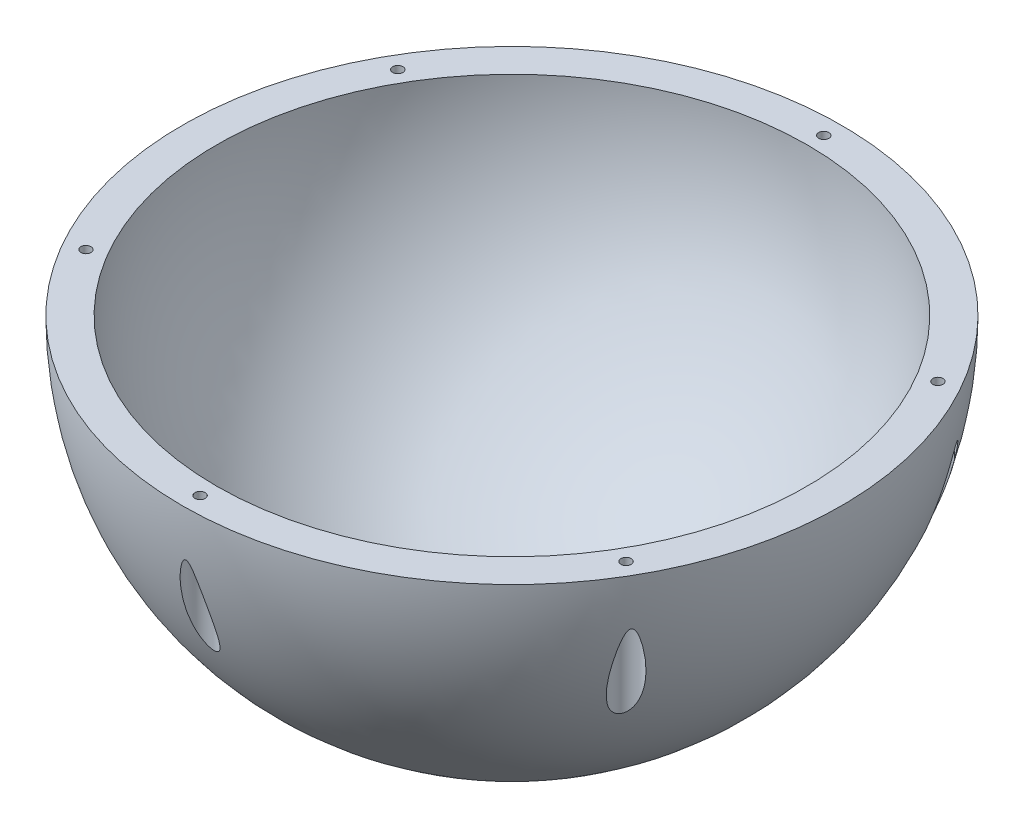
from build123d import *

# Parameters (mm, degrees)
SKETCH1_R           = 92.075
BOSS_EXTRUDE3_DEPTH = 92.075
SKETCH3_R           = 82.55
CUT_EXTRUDE1_DEPTH  = 82.55
FILLET12_R          = 82.55
FILLET13_R          = 92.075
SKETCH6_R           = 3.937
CUT_EXTRUDE3_DEPTH  = 50.8
SKETCH8_R           = 3.937
SKETCH8_R_2         = 1.4224
BOSS_EXTRUDE6_DEPTH = 3.175


with BuildPart() as part:
    # Sketch1 → Boss-Extrude3 (new body)
    with BuildSketch(Plane(origin=(0, 0, 0), x_dir=(1, 0, 0), z_dir=(0, 1, 0))):
        with Locations(Location((0, 0, 0), (0, 0, 270))):
            Circle(SKETCH1_R)
    extrude(amount=BOSS_EXTRUDE3_DEPTH)

    # Sketch3 → Cut-Extrude1 (cut)
    with BuildSketch(Plane(origin=(0, 92.075, 0), x_dir=(1, 0, 0), z_dir=(0, 1, 0))):
        with Locations(Location((0, 0, 0), (0, 0, 270))):
            Circle(SKETCH3_R)
    extrude(amount=-CUT_EXTRUDE1_DEPTH, mode=Mode.SUBTRACT)

    # Fillet12
    fillet12_edges = [part.edges().sort_by_distance(p)[0] for p in [
        (0, 9.525, -82.55),
    ]]
    fillet(fillet12_edges, radius=FILLET12_R - 0.0001)  # a hair under: the kernel refuses the full size

    # Fillet13
    fillet13_edges = [part.edges().sort_by_distance(p)[0] for p in [
        (0, 0, -92.075),
    ]]
    fillet(fillet13_edges, radius=FILLET13_R - 0.0001)  # a hair under: the kernel refuses the full size

    # Sketch6 → Cut-Extrude3 (cut)
    with BuildSketch(Plane(origin=(0, 92.075, 0), x_dir=(1, 0, 0), z_dir=(0, 1, 0))):
        with Locations(Location((0, 87.122, 0), (0, 0, 270))):
            Circle(SKETCH6_R)
        with Locations(Location((75.449865229, 43.561, 0), (0, 0, 270))):
            Circle(SKETCH6_R)
        with Locations(Location((75.449865229, -43.561, 0), (0, 0, 270))):
            Circle(SKETCH6_R)
        with Locations(Location((0, -87.122, 0), (0, 0, 270))):
            Circle(SKETCH6_R)
        with Locations(Location((-75.449865229, -43.561, 0), (0, 0, 270))):
            Circle(SKETCH6_R)
        with Locations(Location((-75.449865229, 43.561, 0), (0, 0, 270))):
            Circle(SKETCH6_R)
    extrude(amount=-CUT_EXTRUDE3_DEPTH, mode=Mode.SUBTRACT)

    # Sketch8 → Boss-Extrude6 (add)
    # profile 1 of 6: a face of its own
    with BuildSketch(Plane(origin=(0, 92.075, 0), x_dir=(1, 0, 0), z_dir=(0, 1, 0))):
        with Locations(Location((-75.449865229, -43.561, 0), (0, 0, 270))):
            Circle(SKETCH8_R)
        with Locations(Location((-75.449865229, -43.561, 0), (0, 0, 270))):
            Circle(SKETCH8_R_2, mode=Mode.SUBTRACT)
    # profile 2 of 6: a face of its own
    with BuildSketch(Plane(origin=(0, 92.075, 0), x_dir=(1, 0, 0), z_dir=(0, 1, 0))):
        with Locations(Location((0, -87.122, 0), (0, 0, 270))):
            Circle(SKETCH8_R)
        with Locations(Location((0, -87.122, 0), (0, 0, 270))):
            Circle(SKETCH8_R_2, mode=Mode.SUBTRACT)
    # profile 3 of 6: a face of its own
    with BuildSketch(Plane(origin=(0, 92.075, 0), x_dir=(1, 0, 0), z_dir=(0, 1, 0))):
        with Locations(Location((75.449865229, -43.561, 0), (0, 0, 270))):
            Circle(SKETCH8_R)
        with Locations(Location((75.449865229, -43.561, 0), (0, 0, 270))):
            Circle(SKETCH8_R_2, mode=Mode.SUBTRACT)
    # profile 4 of 6: a face of its own
    with BuildSketch(Plane(origin=(0, 92.075, 0), x_dir=(1, 0, 0), z_dir=(0, 1, 0))):
        with Locations(Location((75.449865229, 43.561, 0), (0, 0, 270))):
            Circle(SKETCH8_R)
        with Locations(Location((75.449865229, 43.561, 0), (0, 0, 270))):
            Circle(SKETCH8_R_2, mode=Mode.SUBTRACT)
    # profile 5 of 6: a face of its own
    with BuildSketch(Plane(origin=(0, 92.075, 0), x_dir=(1, 0, 0), z_dir=(0, 1, 0))):
        with Locations(Location((0, 87.122, 0), (0, 0, 270))):
            Circle(SKETCH8_R)
        with Locations(Location((0, 87.122, 0), (0, 0, 270))):
            Circle(SKETCH8_R_2, mode=Mode.SUBTRACT)
    # profile 6 of 6: a face of its own
    with BuildSketch(Plane(origin=(0, 92.075, 0), x_dir=(1, 0, 0), z_dir=(0, 1, 0))):
        with Locations(Location((-75.449865229, 43.561, 0), (0, 0, 270))):
            Circle(SKETCH8_R)
        with Locations(Location((-75.449865229, 43.561, 0), (0, 0, 270))):
            Circle(SKETCH8_R_2, mode=Mode.SUBTRACT)
    extrude(amount=-BOSS_EXTRUDE6_DEPTH)


solid = part.part
